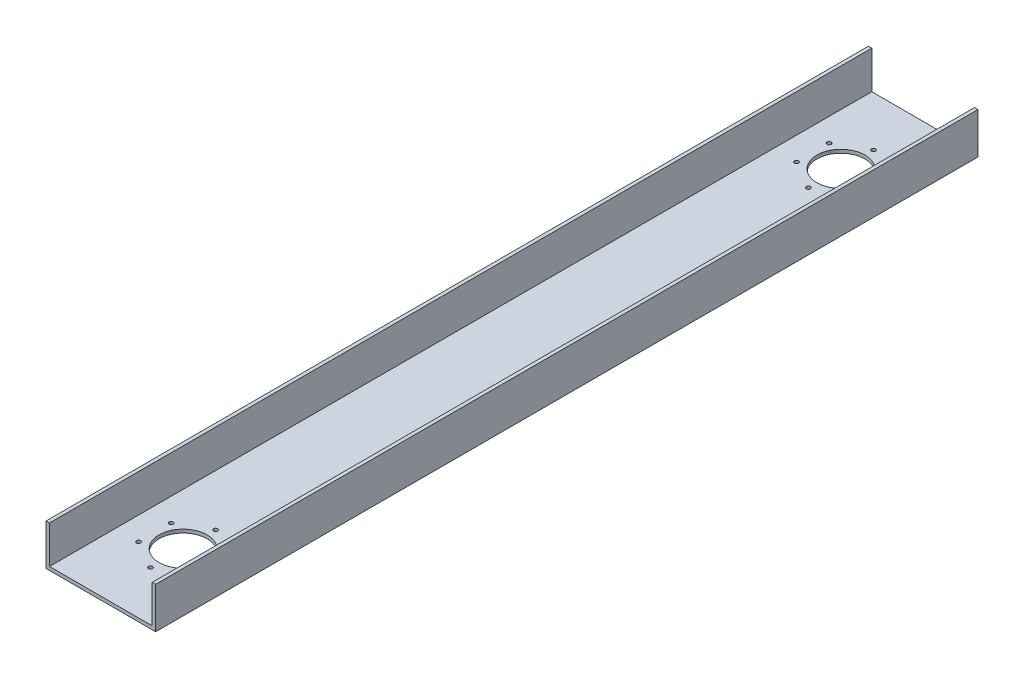
from build123d import *

# Parameters (mm, degrees)
BOSS_EXTRUDE1_DEPTH = 762
CUT_EXTRUDE1_REACH  = 771.687
SKETCH2_R           = 22.2377
CUT_EXTRUDE2_REACH  = 771.687
SKETCH3_R           = 1.89865


with BuildPart() as part:
    # Sketch1 → Boss-Extrude1 (new body)
    with BuildSketch(Plane.XY):
        Polygon((3.175, 3.175), (3.175, 38.1), (0, 38.1), (0, 0), (101.6, 0), (101.6, 38.1), (98.425, 38.1), (98.425, 3.175), align=None)
    extrude(amount=BOSS_EXTRUDE1_DEPTH)

    # Sketch2 → Cut-Extrude1 (cut, up to next)
    with BuildSketch(Plane.XZ, mode=Mode.PRIVATE) as cut_extrude1_sk1:
        with Locations((50.8, 685.8)):
            Circle(SKETCH2_R)
    cut_extrude1_tool1 = extrude(cut_extrude1_sk1.sketch, amount=-CUT_EXTRUDE1_REACH, mode=Mode.PRIVATE) & part.part
    cut_extrude1 = cut_extrude1_tool1.solids().sort_by_distance((50.8, 0, 685.8))[0]
    add(cut_extrude1, mode=Mode.SUBTRACT)

    # Sketch3 → Cut-Extrude2 (cut, up to next)
    with BuildSketch(Plane.XZ, mode=Mode.PRIVATE) as cut_extrude2_sk1:
        with Locations((50.8, 715.9625)):
            Circle(SKETCH3_R)
    cut_extrude2_tool1 = extrude(cut_extrude2_sk1.sketch, amount=-CUT_EXTRUDE2_REACH, mode=Mode.PRIVATE) & part.part
    # Sketch3 → Cut-Extrude2 (cut, up to next)
    with BuildSketch(Plane.XZ, mode=Mode.PRIVATE) as cut_extrude2_sk2:
        with Locations((76.921491242, 700.88125)):
            Circle(SKETCH3_R)
    cut_extrude2_tool2 = extrude(cut_extrude2_sk2.sketch, amount=-CUT_EXTRUDE2_REACH, mode=Mode.PRIVATE) & part.part
    # Sketch3 → Cut-Extrude2 (cut, up to next)
    with BuildSketch(Plane.XZ, mode=Mode.PRIVATE) as cut_extrude2_sk3:
        with Locations((76.921491242, 670.71875)):
            Circle(SKETCH3_R)
    cut_extrude2_tool3 = extrude(cut_extrude2_sk3.sketch, amount=-CUT_EXTRUDE2_REACH, mode=Mode.PRIVATE) & part.part
    # Sketch3 → Cut-Extrude2 (cut, up to next)
    with BuildSketch(Plane.XZ, mode=Mode.PRIVATE) as cut_extrude2_sk4:
        with Locations((50.8, 655.6375)):
            Circle(SKETCH3_R)
    cut_extrude2_tool4 = extrude(cut_extrude2_sk4.sketch, amount=-CUT_EXTRUDE2_REACH, mode=Mode.PRIVATE) & part.part
    # Sketch3 → Cut-Extrude2 (cut, up to next)
    with BuildSketch(Plane.XZ, mode=Mode.PRIVATE) as cut_extrude2_sk5:
        with Locations((24.678508758, 670.71875)):
            Circle(SKETCH3_R)
    cut_extrude2_tool5 = extrude(cut_extrude2_sk5.sketch, amount=-CUT_EXTRUDE2_REACH, mode=Mode.PRIVATE) & part.part
    # Sketch3 → Cut-Extrude2 (cut, up to next)
    with BuildSketch(Plane.XZ, mode=Mode.PRIVATE) as cut_extrude2_sk6:
        with Locations((24.678508758, 700.88125)):
            Circle(SKETCH3_R)
    cut_extrude2_tool6 = extrude(cut_extrude2_sk6.sketch, amount=-CUT_EXTRUDE2_REACH, mode=Mode.PRIVATE) & part.part
    cut_extrude2_1 = cut_extrude2_tool1.solids().sort_by_distance((50.8, 0, 715.9625))[0]
    add(cut_extrude2_1, mode=Mode.SUBTRACT)
    cut_extrude2_2 = cut_extrude2_tool2.solids().sort_by_distance((76.921491, 0, 700.88125))[0]
    add(cut_extrude2_2, mode=Mode.SUBTRACT)
    cut_extrude2_3 = cut_extrude2_tool3.solids().sort_by_distance((76.921491, 0, 670.71875))[0]
    add(cut_extrude2_3, mode=Mode.SUBTRACT)
    cut_extrude2_4 = cut_extrude2_tool4.solids().sort_by_distance((50.8, 0, 655.6375))[0]
    add(cut_extrude2_4, mode=Mode.SUBTRACT)
    cut_extrude2_5 = cut_extrude2_tool5.solids().sort_by_distance((24.678509, 0, 670.71875))[0]
    add(cut_extrude2_5, mode=Mode.SUBTRACT)
    cut_extrude2_6 = cut_extrude2_tool6.solids().sort_by_distance((24.678509, 0, 700.88125))[0]
    add(cut_extrude2_6, mode=Mode.SUBTRACT)
    cut_extrude2 = cut_extrude2_1 + cut_extrude2_2 + cut_extrude2_3 + cut_extrude2_4 + cut_extrude2_5 + cut_extrude2_6  # Cut-Extrude2 as one shape, for the pattern or mirror that repeats it

    # Mirror1: Cut-Extrude1, Cut-Extrude2 across plane
    add(cut_extrude1.mirror(Plane.XY.offset(381)), mode=Mode.SUBTRACT)
    add(cut_extrude2.mirror(Plane.XY.offset(381)), mode=Mode.SUBTRACT)


solid = part.part
